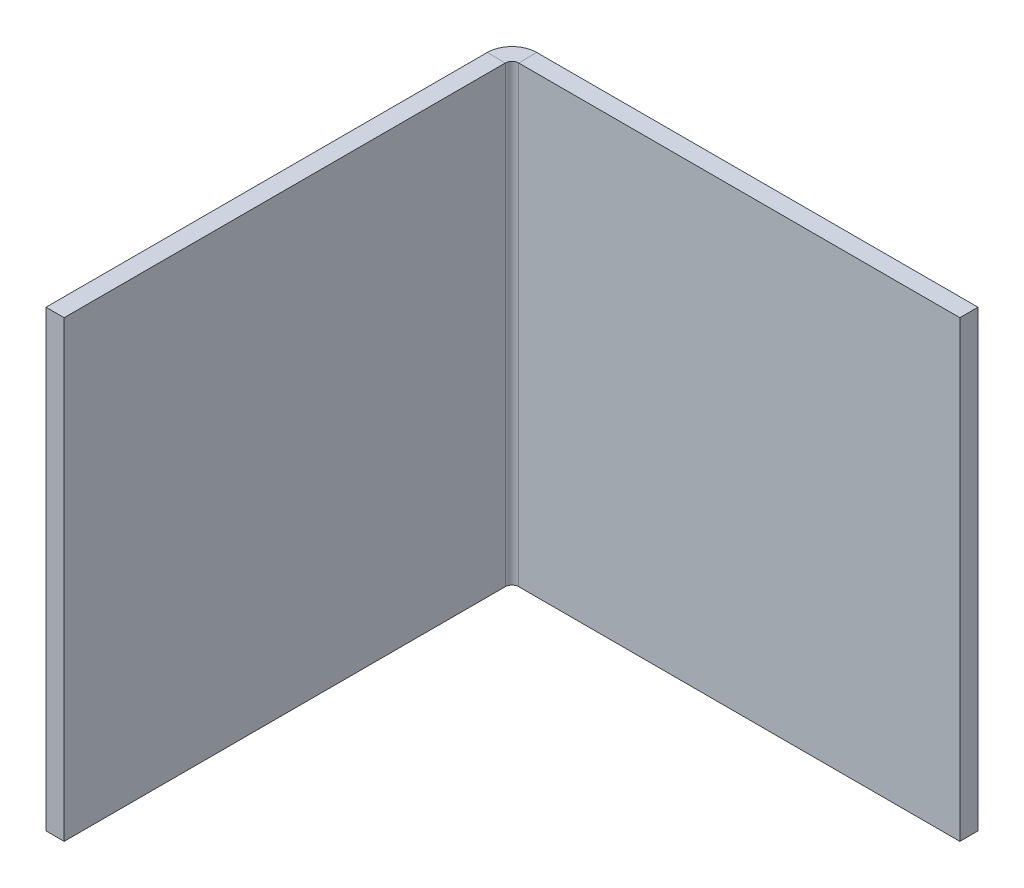
from build123d import *

# Parameters (mm, degrees)
SKETCH_1_W             = 100
SKETCH_1_H             = 50
SM_BASE_FLANGE_2_DEPTH = 2
OTHER_START            = -25
OTHER_1_DEPTH          = 50
OTHER_1_2_DEPTH        = 50


# Read off the part's stored shape, not the designer's step: Нарисованный сгиб1
# Sheet-metal steps are written as plain solids
with BuildPart() as part:
    # Эскиз1 → Базовая кромка2 (new body)
    with BuildSketch(Plane.XY):
        Rectangle(SKETCH_1_W, SKETCH_1_H)
    extrude(amount=-SM_BASE_FLANGE_2_DEPTH)

    # Other 1 outline → Other 1 (cut)
    with BuildSketch(Plane(origin=(0, 0, 0), x_dir=(1, 0, 0), z_dir=(0, 1, 0)).offset(OTHER_START)):
        with BuildLine():
            Line((-50, 0), (-1.271679947, 0))
            ThreePointArc((-1.271679947, 0), (-0.290344758, 1.443395312), (1.363922451, 2))
            Line((1.363922451, 2), (-50, 2))
            Line((-50, 2), (-50, 0))
        make_face()
    extrude(amount=OTHER_1_DEPTH, mode=Mode.SUBTRACT)

    # Other 1 2 outline → Other 1 2 (add)
    with BuildSketch(Plane(origin=(0, 0, 0), x_dir=(1, 0, 0), z_dir=(0, 1, 0)).offset(OTHER_START)):
        with BuildLine():
            ThreePointArc((-1.271679947, 0), (-1.347310579, -0.364854094), (-1.372677549, -0.7366))
            Line((-1.372677549, -0.7366), (-1.372677549, -49.372677549))
            Line((-1.372677549, -49.372677549), (0.627322451, -49.372677549))
            Line((0.627322451, -49.372677549), (0.627322451, -0.7366))
            ThreePointArc((0.627322451, -0.7366), (0.843067596, -0.215745145), (1.363922451, 0))
            Line((1.363922451, 0), (-1.271679947, 0))
        make_face()
    extrude(amount=OTHER_1_2_DEPTH)


solid = part.part
